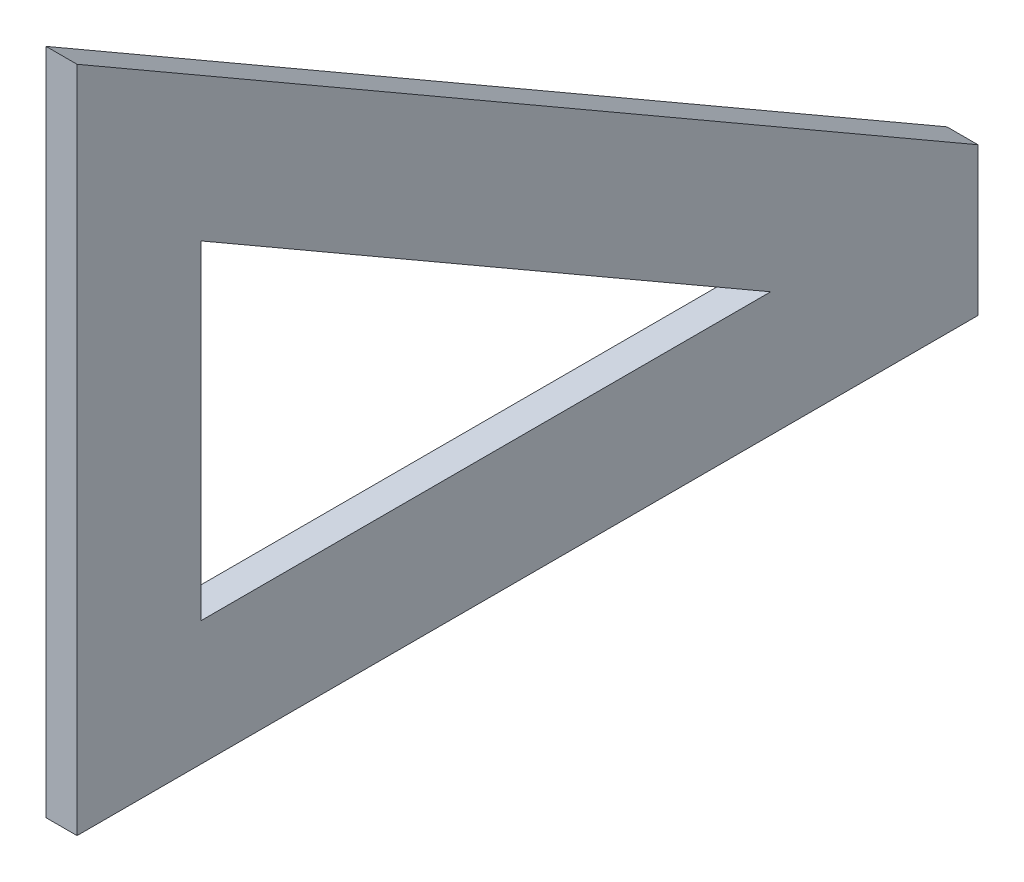
from build123d import *

# Parameters (mm, degrees)
BOSS_EXTRUDE1_DEPTH = 3.175
CUT_EXTRUDE1_DEPTH  = 6.35


with BuildPart() as part:
    # Sketch1 → Boss-Extrude1 (new, symmetric)
    with BuildSketch(Plane.ZY.offset(32.038437852)):
        Polygon((-213.509598145, 95.25), (-213.509598145, 125.492599154), (-29.238522478, 231.881554295), (-29.238522478, 95.25), align=None)
    extrude(amount=BOSS_EXTRUDE1_DEPTH, both=True)

    # Sketch2 → Cut-Extrude1 (cut)
    with BuildSketch(Plane.ZY.offset(35.213437852)):
        Polygon((-54.638522478, 120.65), (-54.638522478, 187.887463782), (-171.097225921, 120.65), align=None)
    extrude(amount=-CUT_EXTRUDE1_DEPTH, mode=Mode.SUBTRACT)


solid = part.part
